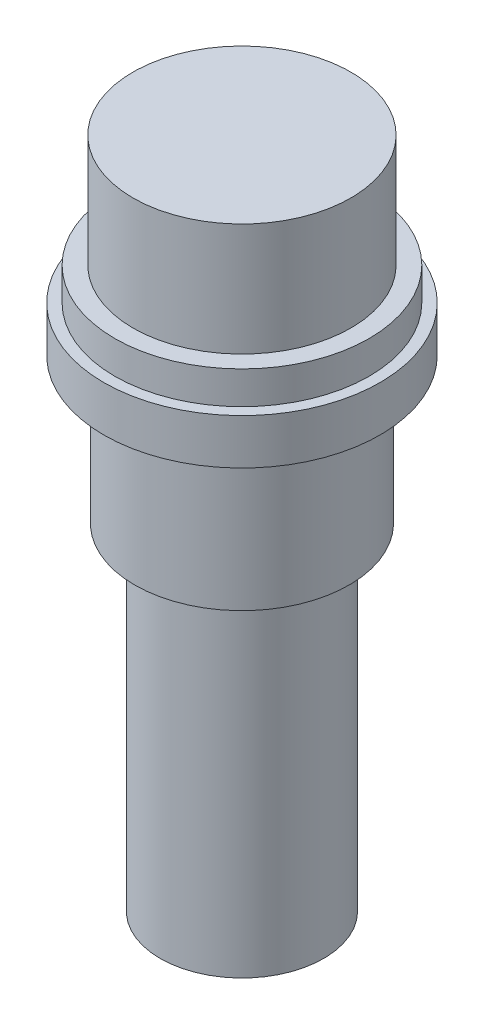
from build123d import *


with BuildPart() as part:
    # 草图1 → 旋转1 (revolve)
    with BuildSketch(Plane.XY):
        Polygon((0, 30.938694357), (6, 30.938694357), (6, 24.738694357), (7, 24.738694357), (7, 22.938694357), (7.6, 22.938694357), (7.6, 20.438694357), (5.9, 20.438694357), (5.9, 12.438694357), (4.5, 12.438694357), (4.5, -6.061305643), (0, -6.061305643), align=None)
    revolve(axis=Axis((0, 77.721825963, 0), (0, -1, 0)))


solid = part.part
